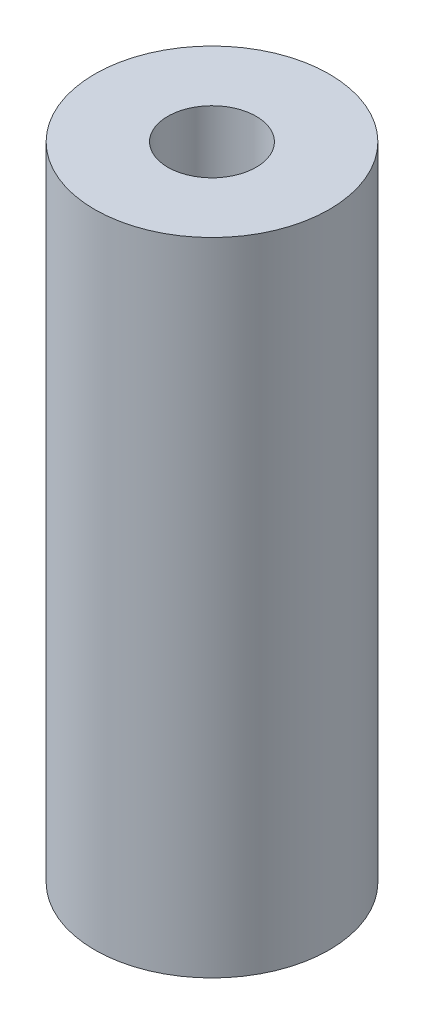
from build123d import *

# Parameters (mm, degrees)
SKETCH1_R             = 3
BOSS_EXTRUDE1_DEPTH   = 16.4
F_4_40_TAPPED_HOLE1_D = 2.2606


with BuildPart() as part:
    # Sketch1 → Boss-Extrude1 (new body)
    with BuildSketch(Plane(origin=(0, 0, 0), x_dir=(1, 0, 0), z_dir=(0, 1, 0))):
        Circle(SKETCH1_R)
    extrude(amount=BOSS_EXTRUDE1_DEPTH)

    # #4-40 Tapped Hole1 (through all)
    with Locations(Plane(origin=(0, 16.4, 0), x_dir=(1, 0, 0), z_dir=(0, 1, 0))):
        with Locations((0, 0)):
            Hole(F_4_40_TAPPED_HOLE1_D / 2)


solid = part.part
